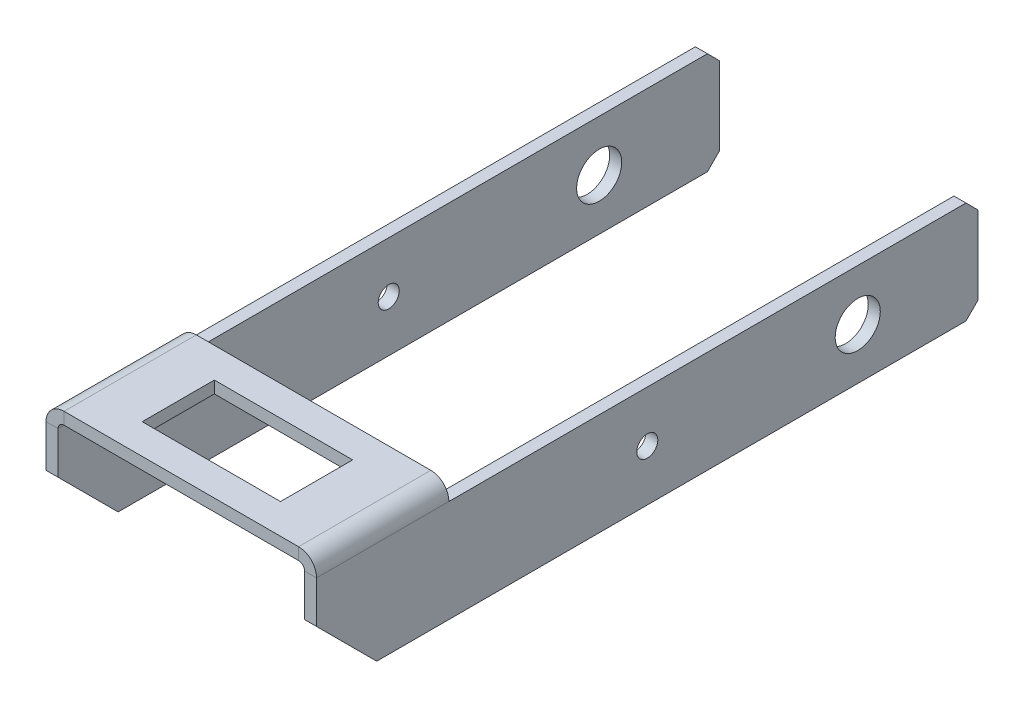
from build123d import *

# Parameters (mm, degrees)
SKETCH1_W                      = 45
SKETCH1_H                      = 22
BASE_FLANGE1_DEPTH             = 2
EDGE_FLANGE1_STRIP_W           = 10
EDGE_FLANGE1_STRIP_H           = 2
EDGE_FLANGE1_STRIP_CUT_DEPTH   = 22
EDGE_FLANGE1_STRIP_2_W         = 10
EDGE_FLANGE1_STRIP_2_H         = 2
EDGE_FLANGE1_STRIP_CUT_2_DEPTH = 22
EDGE_FLANGE1_DEPTH             = 22
EDGE_FLANGE1_PROFILE_W         = 110
EDGE_FLANGE1_PROFILE_H         = 17
EDGE_FLANGE1_FLAT_DEPTH        = 2
EDGE_FLANGE1_BEND_DEPTH        = 22
EDGE_FLANGE1_PROFILE_2_W       = 110
EDGE_FLANGE1_PROFILE_2_H       = 17
EDGE_FLANGE1_FLAT_2_DEPTH      = 2
SKETCH24_R                     = 3.75
CUT_EXTRUDE1_DEPTH             = 10
CUT_EXTRUDE2_START             = -10
SKETCH25_R                     = 3.75
CUT_EXTRUDE2_DEPTH             = 10
SKETCH28_R                     = 1.75
CUT_EXTRUDE3_DEPTH             = 121.203993278
SKETCH29_W                     = 23
SKETCH29_H                     = 12
CUT_EXTRUDE4_DEPTH             = 10
CHAMFER1_SIZE                  = 2
CHAMFER2_SIZE                  = 10


# Sheet-metal steps are written as plain solids
with BuildPart() as part:
    # Sketch1 → Base-Flange1 (new body)
    with BuildSketch(Plane(origin=(0, 0, 0), x_dir=(1, 0, 0), z_dir=(0, 1, 0))):
        with Locations((22.5, 11)):
            Rectangle(SKETCH1_W, SKETCH1_H)
    extrude(amount=BASE_FLANGE1_DEPTH)

    # Edge-Flange1 strip (across the edge) → Edge-Flange1 strip cut (cut)
    with BuildSketch(Plane(origin=(45, 0, -22), x_dir=(-1, 0, 0), z_dir=(0, 0, 1))):
        with Locations((-2, -1)):
            Rectangle(EDGE_FLANGE1_STRIP_W, EDGE_FLANGE1_STRIP_H)
    extrude(amount=EDGE_FLANGE1_STRIP_CUT_DEPTH, mode=Mode.SUBTRACT)

    # Edge-Flange1 strip 2 (across the edge) → Edge-Flange1 strip cut 2 (cut)
    with BuildSketch(Plane(origin=(0, 0, 0), x_dir=(1, 0, 0), z_dir=(0, 0, -1))):
        with Locations((-2, -1)):
            Rectangle(EDGE_FLANGE1_STRIP_2_W, EDGE_FLANGE1_STRIP_2_H)
    extrude(amount=EDGE_FLANGE1_STRIP_CUT_2_DEPTH, mode=Mode.SUBTRACT)

    # Edge-Flange1 bend section (across the edge) → Edge-Flange1 (add)
    with BuildSketch(Plane(origin=(45, 0, -22), x_dir=(-1, 0, 0), z_dir=(0, 0, 1))):
        with BuildLine():
            Line((0, 1), (2, 1))
            ThreePointArc((2, 1), (2.292893219, 0.292893219), (3, 0))
            Line((3, 0), (3, -2))
            ThreePointArc((3, -2), (0.878679656, -1.121320344), (0, 1))
        make_face()
    extrude(amount=EDGE_FLANGE1_DEPTH)

    # Edge-Flange1 profile (on flange) → Edge-Flange1 flat (add)
    with BuildSketch(Plane(origin=(45, 0, 0), x_dir=(0, 0, 1), z_dir=(1, 0, 0))):
        with Locations((-55, 9.5)):
            Rectangle(EDGE_FLANGE1_PROFILE_W, EDGE_FLANGE1_PROFILE_H)
    extrude(amount=-EDGE_FLANGE1_FLAT_DEPTH)

    # Edge-Flange1 bend section 2 (across the edge) → Edge-Flange1 bend (add)
    with BuildSketch(Plane(origin=(0, 0, 0), x_dir=(1, 0, 0), z_dir=(0, 0, -1))):
        with BuildLine():
            Line((0, 1), (2, 1))
            ThreePointArc((2, 1), (2.292893219, 0.292893219), (3, 0))
            Line((3, 0), (3, -2))
            ThreePointArc((3, -2), (0.878679656, -1.121320344), (0, 1))
        make_face()
    extrude(amount=EDGE_FLANGE1_BEND_DEPTH)

    # Edge-Flange1 profile 2 (on flange) → Edge-Flange1 flat 2 (add)
    with BuildSketch(Plane(origin=(0, 0, 0), x_dir=(0, 0, -1), z_dir=(-1, 0, 0))):
        with Locations((55, 9.5)):
            Rectangle(EDGE_FLANGE1_PROFILE_2_W, EDGE_FLANGE1_PROFILE_2_H)
    extrude(amount=-EDGE_FLANGE1_FLAT_2_DEPTH)

    # Sketch24 → Cut-Extrude1 (cut)
    with BuildSketch(Plane(origin=(45, 0, 0), x_dir=(0, 0, -1), z_dir=(1, 0, 0))):
        with Locations(Location((90, -9.5, 0), (0, 0, 90))):
            Circle(SKETCH24_R)
    extrude(amount=-CUT_EXTRUDE1_DEPTH, mode=Mode.SUBTRACT)

    # Sketch25 → Cut-Extrude2 (cut)
    with BuildSketch(Plane.ZY.offset(CUT_EXTRUDE2_START)):
        with Locations(Location((-90, -9.5, 0), (0, 0, 90))):
            Circle(SKETCH25_R)
    extrude(amount=CUT_EXTRUDE2_DEPTH, mode=Mode.SUBTRACT)

    # Sketch28 → Cut-Extrude3 (cut, through all)
    with BuildSketch(Plane.ZY):
        with Locations(Location((-55, -9.5, 0), (0, 0, 270))):
            Circle(SKETCH28_R)
    extrude(amount=-CUT_EXTRUDE3_DEPTH, mode=Mode.SUBTRACT)

    # Sketch29 → Cut-Extrude4 (cut)
    with BuildSketch(Plane(origin=(0, 2, 0), x_dir=(1, 0, 0), z_dir=(0, 1, 0))):
        with Locations((22.5, 11)):
            Rectangle(SKETCH29_W, SKETCH29_H)
    extrude(amount=-CUT_EXTRUDE4_DEPTH, mode=Mode.SUBTRACT)

    # Chamfer1
    chamfer1_edges = [part.edges().sort_by_distance(p)[0] for p in [
        (44, -1, -110),
        (44, -18, -110),
        (1, -1, -110),
        (1, -18, -110),
    ]]
    chamfer(chamfer1_edges, length=CHAMFER1_SIZE)

    # Chamfer2
    chamfer2_edges = [part.edges().sort_by_distance(p)[0] for p in [
        (44, -18, 0),
        (1, -18, 0),
    ]]
    chamfer(chamfer2_edges, length=CHAMFER2_SIZE)


solid = part.part
